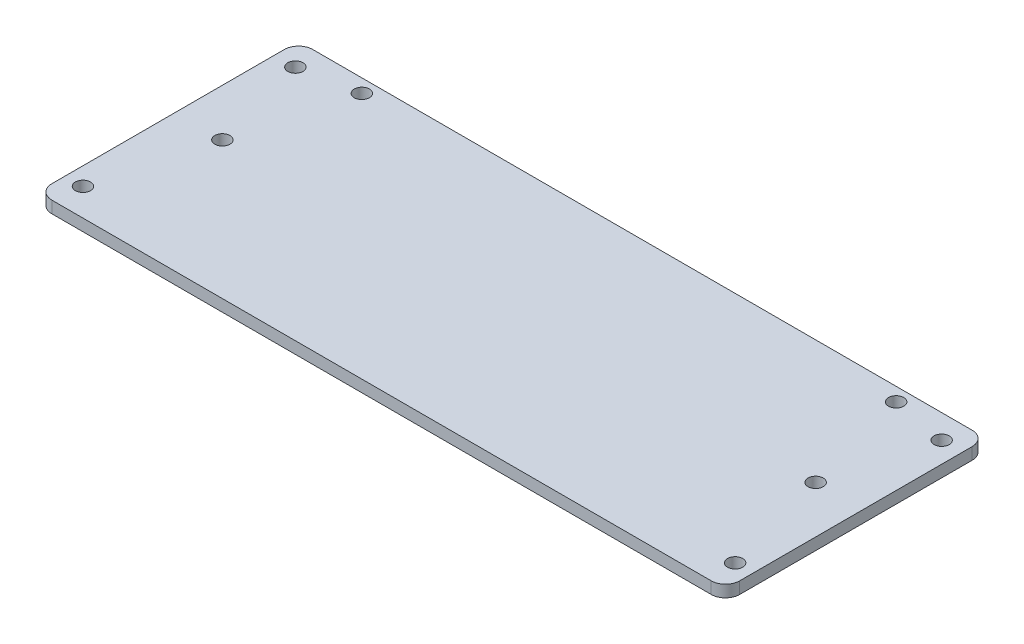
from build123d import *

# Parameters (mm, degrees)
SKETCH1_W           = 184.15
SKETCH1_H           = 69.85
BOSS_EXTRUDE1_DEPTH = 3.175
FILLET1_R           = 3.81
SKETCH2_R           = 2.032
CUT_EXTRUDE1_DEPTH  = 197.977982589


with BuildPart() as part:
    # Sketch1 → Boss-Extrude1 (new body)
    with BuildSketch(Plane(origin=(0, 0, 0), x_dir=(1, 0, 0), z_dir=(0, 1, 0))):
        with Locations((92.075, -34.925)):
            Rectangle(SKETCH1_W, SKETCH1_H)
    extrude(amount=BOSS_EXTRUDE1_DEPTH)

    # Fillet1
    fillet1_edges = [part.edges().sort_by_distance(p)[0] for p in [
        (184.15, 1.5875, 0),
        (184.15, 1.5875, 69.85),
        (0, 1.5875, 0),
        (0, 1.5875, 69.85),
    ]]
    fillet(fillet1_edges, radius=FILLET1_R)

    # Sketch2 → Cut-Extrude1 (cut, through all)
    with BuildSketch(Plane(origin=(0, 3.175, 0), x_dir=(1, 0, 0), z_dir=(0, 1, 0))):
        with Locations((4.774294029, -62.489645204)):
            Circle(SKETCH2_R)
        with Locations((12.663098524, -33.048226018)):
            Circle(SKETCH2_R)
        with Locations((20.551903019, -3.606806833)):
            Circle(SKETCH2_R)
        with Locations((5.564504018, -6.410114401)):
            Circle(SKETCH2_R)
        with Locations((179.375705971, -62.489645204)):
            Circle(SKETCH2_R)
        with Locations((171.486901476, -33.048226018)):
            Circle(SKETCH2_R)
        with Locations((178.585495982, -6.410114401)):
            Circle(SKETCH2_R)
        with Locations((163.598096981, -3.606806833)):
            Circle(SKETCH2_R)
    extrude(amount=-CUT_EXTRUDE1_DEPTH, mode=Mode.SUBTRACT)


solid = part.part
